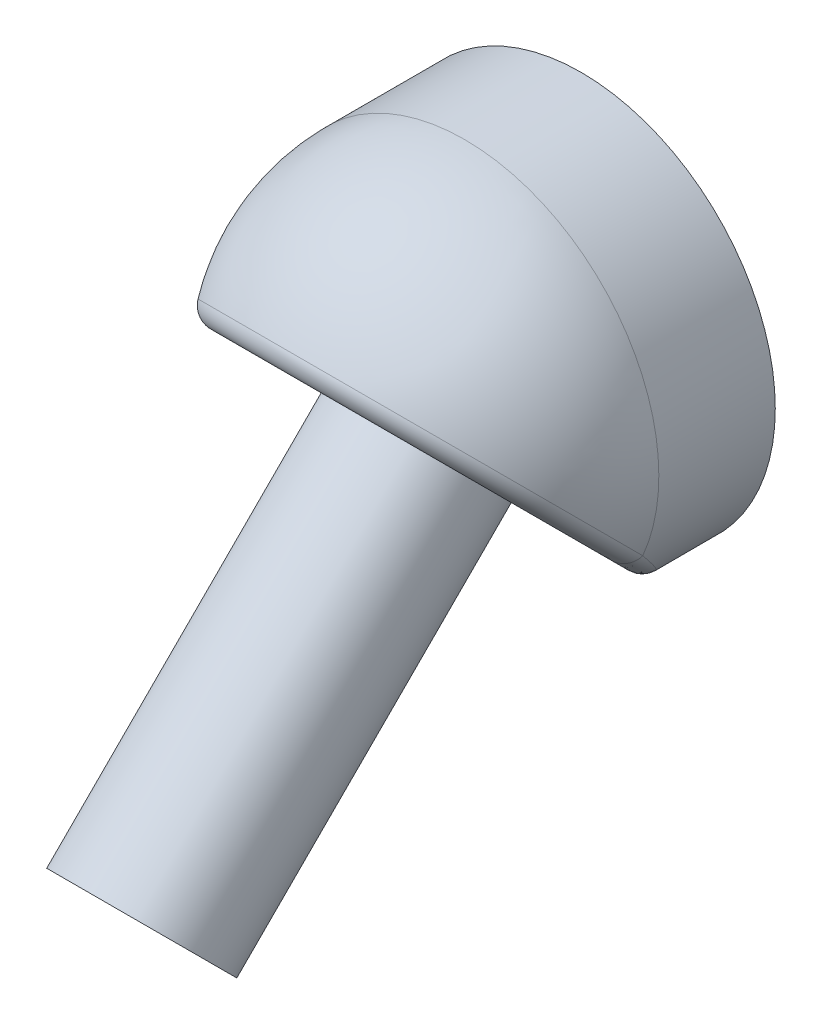
from build123d import *

# Parameters (mm, degrees)
SKETCH_2_R      = 1
EXTRUDE_1_DEPTH = 1.6
FILLET_2_R      = 1
FILLET_3_R      = 0.1
SKETCH_4_R      = 0.4
EXTRUDE_2_DEPTH = 2


# Read off the part's stored shape, not the designer's step: Тело-Удалить/Сохранить 1
with BuildPart() as part:
    # Эскиз2 → Бобышка-Вытянуть1 (new body)
    with BuildSketch(Plane.XY):
        with Locations((-3.5, 0)):
            Circle(SKETCH_2_R)
    extrude(amount=EXTRUDE_1_DEPTH)

    # Скругление2
    fillet_2_edges = [part.edges().sort_by_distance(p)[0] for p in [
        (-4.5, 0, 1.6),
    ]]
    fillet(fillet_2_edges, radius=FILLET_2_R)


with BuildPart() as body_2:
    # Split Bodies 1: the piece on the far side of the plane
    add(part.part)
    split(bisect_by=Plane(origin=(0, -0.55, 0.55), x_dir=(0, -0.7071067811865464, -0.7071067811865488), z_dir=(0, -0.7071067811865488, 0.7071067811865464)), keep=Keep.BOTTOM)

    # Скругление3
    fillet_3_edges = [body_2.edges().sort_by_distance(p)[0] for p in [
        (-3.853553391, 0.362372436, 1.462372436),
        (-3.499999994, -1, 0.1),
    ]]
    fillet(fillet_3_edges, radius=FILLET_3_R)

    # Эскиз4 → Бобышка-Вытянуть2 (add)
    with BuildSketch(Plane(origin=(0, -0.55, 0.55), x_dir=(1, 0, 0), z_dir=(0, -0.7071067811865487, 0.7071067811865465))):
        with Locations(Location((-3.5, 0.424264069, 0), (0, 0, 270))):
            Circle(SKETCH_4_R)
    extrude(amount=EXTRUDE_2_DEPTH)


with BuildPart() as part_1:
    add(part.part)

    # Split Bodies 1
    split(bisect_by=Plane(origin=(0, -0.55, 0.55), x_dir=(0, -0.7071067811865464, -0.7071067811865488), z_dir=(0, -0.7071067811865488, 0.7071067811865464)), keep=Keep.TOP)


solid = body_2.part
